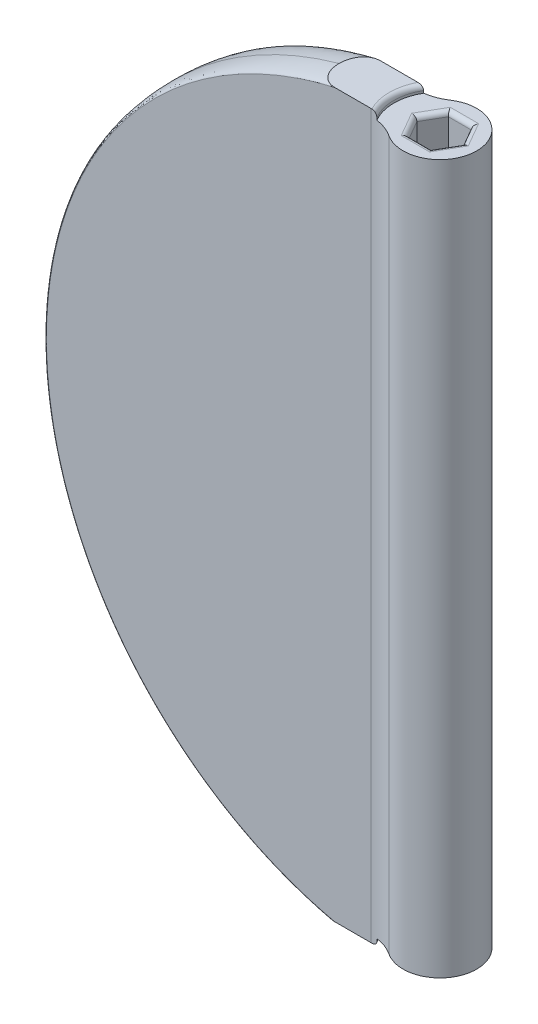
from build123d import *

# Parameters (mm, degrees)
BOSS_EXTRUDE1_DEPTH = 5
SKETCH2_R           = 8
BOSS_EXTRUDE2_DEPTH = 157
FILLET1_R           = 10
CUT_EXTRUDE1_DEPTH  = 30
SKETCH5_R           = 10
CUT_EXTRUDE2_DEPTH  = 1.5
FILLET2_SIZE        = 5
FILLET2_SIZE_2      = 1
FILLET4_R           = 1


with BuildPart() as part:
    # Sketch1 → Boss-Extrude1 (new, symmetric)
    with BuildSketch(Plane.XY):
        with BuildLine():
            Line((0, 78.5), (0, -78.5))
            Line((0, -78.5), (-21.9089023, -78.5))
            ThreePointArc((-21.9089023, -78.5), (-81.5, 0), (-21.9089023, 78.5))
            Line((-21.9089023, 78.5), (0, 78.5))
        make_face()
    extrude(amount=BOSS_EXTRUDE1_DEPTH, both=True)

    # Sketch2 → Boss-Extrude2 (add)
    with BuildSketch(Plane(origin=(0, 78.5, 0), x_dir=(1, 0, 0), z_dir=(0, 1, 0))):
        Circle(SKETCH2_R)
    extrude(amount=-BOSS_EXTRUDE2_DEPTH)

    # Fillet1
    fillet1_edges = [part.edges().sort_by_distance(p)[0] for p in [
        (-6.244997998, 0, -5),
        (-6.244997998, 0, 5),
    ]]
    fillet(fillet1_edges, radius=FILLET1_R)

    # Sketch3 → Cut-Extrude1 (cut)
    with BuildSketch(Plane.XZ.offset(78.5)):
        Polygon((2.5, -4.330127019), (5, 0), (2.5, 4.330127019), (-2.5, 4.330127019), (-5, 0), (-2.5, -4.330127019), align=None)
    cut_extrude1 = extrude(amount=-CUT_EXTRUDE1_DEPTH, mode=Mode.SUBTRACT)

    # Sketch5 → Cut-Extrude2 (cut)
    with BuildSketch(Plane.XZ.offset(78.5)):
        Circle(SKETCH5_R)
    cut_extrude2 = extrude(amount=-CUT_EXTRUDE2_DEPTH, mode=Mode.SUBTRACT)

    # Mirror1: Cut-Extrude1, Cut-Extrude2 across plane
    add(cut_extrude1.mirror(Plane.ZX), mode=Mode.SUBTRACT)
    add(cut_extrude2.mirror(Plane.ZX), mode=Mode.SUBTRACT)

    # Fillet2
    # an asymmetric fillet: 5, 1 mm, written as the material it takes off along each edge
    with BuildSketch(Plane(origin=(0, 0, 5), x_dir=(-0.11834786572698561, -0.9929721963266983, 0), z_dir=(0.9929721963266983, -0.11834786572698561, 0))) as fillet2_piece_1:
        with BuildLine():
            Bezier((81.5, FILLET2_SIZE), (81.5, 0), (81.5 - FILLET2_SIZE_2, 0), weights=[1, 0.707106781, 1])
            Line((81.5 - FILLET2_SIZE_2, 0), (81.5, 0))
            Line((81.5, 0), (81.5, FILLET2_SIZE))
        make_face()
    revolve(axis=Axis((0, 0, 5), (0, 0, -1)), revolution_arc=166.406474405, mode=Mode.SUBTRACT)
    with BuildSketch(Plane(origin=(0, 0, -5), x_dir=(-0.11834786572698561, -0.9929721963266983, 0), z_dir=(0.9929721963266983, -0.11834786572698561, 0))) as fillet2_piece_2:
        with BuildLine():
            Bezier((81.5 - FILLET2_SIZE_2, 0), (81.5, 0), (81.5, -FILLET2_SIZE), weights=[1, 0.707106781, 1])
            Line((81.5, -FILLET2_SIZE), (81.5, 0))
            Line((81.5, 0), (81.5 - FILLET2_SIZE_2, 0))
        make_face()
    revolve(axis=Axis((0, 0, -5), (0, 0, -1)), revolution_arc=166.406474405, mode=Mode.SUBTRACT)

    # Fillet4
    fillet4_edges = [part.edges().sort_by_distance(p)[0] for p in [
        (-3.75, 77, -2.165063509),
        (-10, 78.5, 0),
        (3.75, 77, -2.165063509),
        (0, 77, -4.330127019),
        (-3.75, 77, 2.165063509),
        (0, 77, 4.330127019),
        (3.75, 77, 2.165063509),
        (3.75, -77, -2.165063509),
        (-10, -78.5, 0),
        (0, -77, -4.330127019),
        (-3.75, -77, -2.165063509),
        (-3.75, -77, 2.165063509),
        (0, -77, 4.330127019),
        (3.75, -77, 2.165063509),
    ]]
    fillet(fillet4_edges, radius=FILLET4_R)


solid = part.part
